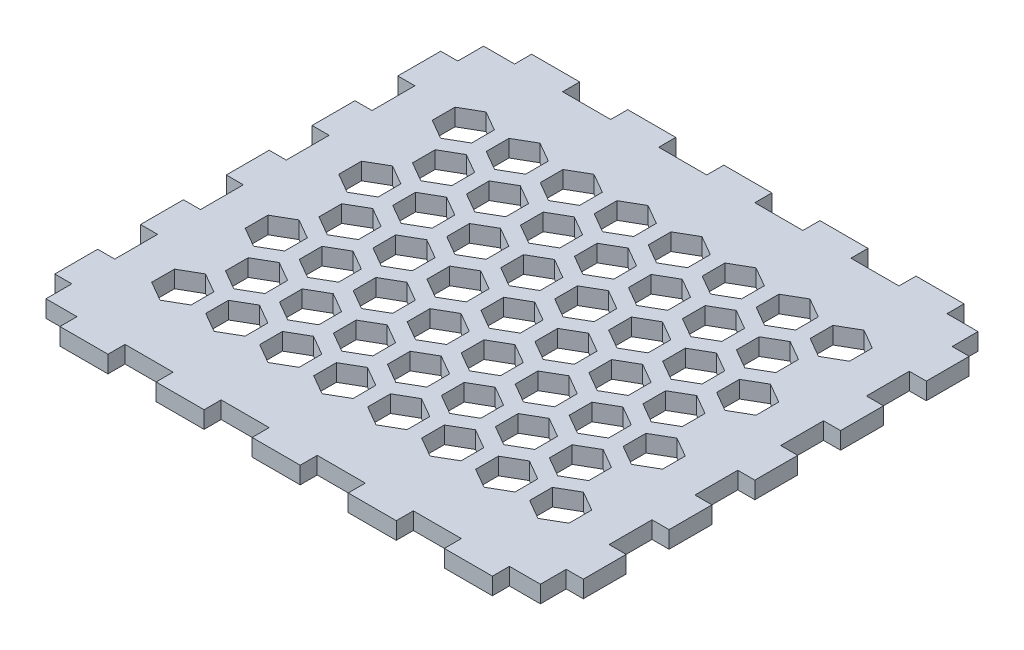
from build123d import *

# Parameters (mm, degrees)
AUFSATZ_LINEAR_AUSTRAGEN1_DEPTH = 3
F_LLMUSTER4_DEPTH               = 3


# Read off the part's stored shape, not the designer's step: Füllmuster4
with BuildPart() as part:
    # Skizze1 → Aufsatz-Linear austragen1 (new body)
    with BuildSketch(Plane(origin=(0, 0, 0), x_dir=(1, 0, 0), z_dir=(0, 1, 0))):
        Polygon((3.000248, 3.066206975), (8.45439, 3.066206975), (8.45439, 0.066212975), (16.908526, 0.066212975), (16.908526, 3.066206975), (25.364186, 3.066206975), (25.364186, 0.066212975), (33.818576, 0.066212975), (33.818576, 3.066206975), (42.272712, 3.066206975), (42.272712, 0.066212975), (50.727102, 0.066212975), (50.727102, 3.066206975), (59.181492, 3.066206975), (59.181492, 0.066212975), (67.636898, 0.066212975), (67.636898, 3.066206975), (76.091034, 3.066206975), (76.091034, 0.066212975), (84.545424, 0.066212975), (84.545424, 3.066206975), (89.99982, 3.066206975), (89.99982, 7.611028975), (92.999814, 7.611028975), (92.999814, 15.157368975), (89.99982, 15.157368975), (89.99982, 22.701930975), (92.999814, 22.701930975), (92.999814, 30.248016975), (89.99982, 30.248016975), (89.99982, 37.792832975), (92.999814, 37.792832975), (92.999814, 45.338918975), (89.99982, 45.338918975), (89.99982, 52.883734975), (92.999814, 52.883734975), (92.999814, 60.430074975), (89.99982, 60.430074975), (89.99982, 67.974382975), (92.999814, 67.974382975), (92.999814, 75.520722975), (89.99982, 75.520722975), (89.99982, 80.065544975), (84.545424, 80.065544975), (84.545424, 83.065538975), (76.091034, 83.065538975), (76.091034, 80.065544975), (67.636898, 80.065544975), (67.636898, 83.065538975), (59.181492, 83.065538975), (59.181492, 80.065544975), (50.727102, 80.065544975), (50.727102, 83.065538975), (42.272712, 83.065538975), (42.272712, 80.065544975), (33.818576, 80.065544975), (33.818576, 83.065538975), (25.364186, 83.065538975), (25.364186, 80.065544975), (16.908526, 80.065544975), (16.908526, 83.065538975), (8.45439, 83.065538975), (8.45439, 80.065544975), (3.000248, 80.065544975), (3.000248, 75.520722975), (0, 75.520722975), (0, 67.974382975), (3.000248, 67.974382975), (3.000248, 60.430074975), (0, 60.430074975), (0, 52.883734975), (3.000248, 52.883734975), (3.000248, 45.338918975), (0, 45.338918975), (0, 37.792832975), (3.000248, 37.792832975), (3.000248, 30.248016975), (0, 30.248016975), (0, 22.701930975), (3.000248, 22.701930975), (3.000248, 15.157368975), (0, 15.157368975), (0, 7.611028975), (3.000248, 7.611028975), align=None)
    extrude(amount=AUFSATZ_LINEAR_AUSTRAGEN1_DEPTH)

    # Füllmuster4 outline → Füllmuster4 (cut)
    with BuildSketch(Plane(origin=(0, 0, 0), x_dir=(1, 0, 0), z_dir=(0, 1, 0))):
        Polygon((9.785932385, 14.884151968), (13.250034, 12.884151968), (16.714135615, 14.884151968), (16.714135615, 18.884151968), (13.250034, 20.884151968), (9.785932385, 18.884151968), align=None)
        Polygon((9.785932385, 35.338634639), (9.785932385, 31.338634639), (13.250034, 29.338634639), (16.714135615, 31.338634639), (16.714135615, 35.338634639), (13.250034, 37.338634639), align=None)
        Polygon((9.785932385, 51.793117311), (9.785932385, 47.793117311), (13.250034, 45.793117311), (16.714135615, 47.793117311), (16.714135615, 51.793117311), (13.250034, 53.793117311), align=None)
        Polygon((9.785932385, 68.247599983), (9.785932385, 64.247599983), (13.250034, 62.247599983), (16.714135615, 64.247599983), (16.714135615, 68.247599983), (13.250034, 70.247599983), align=None)
        Polygon((56.000034, 45.565875975), (52.535932385, 43.565875975), (52.535932385, 39.565875975), (56.000034, 37.565875975), (59.464135615, 39.565875975), (59.464135615, 43.565875975), align=None)
        Polygon((41.750034, 37.338634639), (38.285932385, 35.338634639), (38.285932385, 31.338634639), (41.750034, 29.338634639), (45.214135615, 31.338634639), (45.214135615, 35.338634639), align=None)
        Polygon((27.500034, 29.111393304), (24.035932385, 27.111393304), (24.035932385, 23.111393304), (27.500034, 21.111393304), (30.964135615, 23.111393304), (30.964135615, 27.111393304), align=None)
        Polygon((70.250034, 53.793117311), (66.785932385, 51.793117311), (66.785932385, 47.793117311), (70.250034, 45.793117311), (73.714135615, 47.793117311), (73.714135615, 51.793117311), align=None)
        Polygon((66.785932385, 31.338634639), (70.250034, 29.338634639), (73.714135615, 31.338634639), (73.714135615, 35.338634639), (70.250034, 37.338634639), (66.785932385, 35.338634639), align=None)
        Polygon((24.035932385, 56.020358647), (27.500034, 54.020358647), (30.964135615, 56.020358647), (30.964135615, 60.020358647), (27.500034, 62.020358647), (24.035932385, 60.020358647), align=None)
        Polygon((38.285932385, 47.793117311), (41.750034, 45.793117311), (45.214135615, 47.793117311), (45.214135615, 51.793117311), (41.750034, 53.793117311), (38.285932385, 51.793117311), align=None)
        Polygon((66.785932385, 18.884151968), (66.785932385, 14.884151968), (70.250034, 12.884151968), (73.714135615, 14.884151968), (73.714135615, 18.884151968), (70.250034, 20.884151968), align=None)
        Polygon((66.785932385, 68.247599983), (66.785932385, 64.247599983), (70.250034, 62.247599983), (73.714135615, 64.247599983), (73.714135615, 68.247599983), (70.250034, 70.247599983), align=None)
        Polygon((41.750034, 20.884151968), (38.285932385, 18.884151968), (38.285932385, 14.884151968), (41.750034, 12.884151968), (45.214135615, 14.884151968), (45.214135615, 18.884151968), align=None)
        Polygon((56.000034, 29.111393304), (52.535932385, 27.111393304), (52.535932385, 23.111393304), (56.000034, 21.111393304), (59.464135615, 23.111393304), (59.464135615, 27.111393304), align=None)
        Polygon((76.285932385, 31.338634639), (79.750034, 29.338634639), (83.214135615, 31.338634639), (83.214135615, 35.338634639), (79.750034, 37.338634639), (76.285932385, 35.338634639), align=None)
        Polygon((62.035932385, 39.565875975), (65.500034, 37.565875975), (68.964135615, 39.565875975), (68.964135615, 43.565875975), (65.500034, 45.565875975), (62.035932385, 43.565875975), align=None)
        Polygon((33.535932385, 56.020358647), (37.000034, 54.020358647), (40.464135615, 56.020358647), (40.464135615, 60.020358647), (37.000034, 62.020358647), (33.535932385, 60.020358647), align=None)
        Polygon((19.285932385, 64.247599983), (22.750034, 62.247599983), (26.214135615, 64.247599983), (26.214135615, 68.247599983), (22.750034, 70.247599983), (19.285932385, 68.247599983), align=None)
        Polygon((47.785932385, 47.793117311), (51.250034, 45.793117311), (54.714135615, 47.793117311), (54.714135615, 51.793117311), (51.250034, 53.793117311), (47.785932385, 51.793117311), align=None)
        Polygon((76.285932385, 18.884151968), (76.285932385, 14.884151968), (79.750034, 12.884151968), (83.214135615, 14.884151968), (83.214135615, 18.884151968), (79.750034, 20.884151968), align=None)
        Polygon((76.285932385, 68.247599983), (76.285932385, 64.247599983), (79.750034, 62.247599983), (83.214135615, 64.247599983), (83.214135615, 68.247599983), (79.750034, 70.247599983), align=None)
        Polygon((76.285932385, 51.793117311), (76.285932385, 47.793117311), (79.750034, 45.793117311), (83.214135615, 47.793117311), (83.214135615, 51.793117311), (79.750034, 53.793117311), align=None)
        Polygon((65.500034, 29.111393304), (62.035932385, 27.111393304), (62.035932385, 23.111393304), (65.500034, 21.111393304), (68.964135615, 23.111393304), (68.964135615, 27.111393304), align=None)
        Polygon((51.250034, 20.884151968), (47.785932385, 18.884151968), (47.785932385, 14.884151968), (51.250034, 12.884151968), (54.714135615, 14.884151968), (54.714135615, 18.884151968), align=None)
        Polygon((33.535932385, 23.111393304), (37.000034, 21.111393304), (40.464135615, 23.111393304), (40.464135615, 27.111393304), (37.000034, 29.111393304), (33.535932385, 27.111393304), align=None)
        Polygon((19.285932385, 31.338634639), (22.750034, 29.338634639), (26.214135615, 31.338634639), (26.214135615, 35.338634639), (22.750034, 37.338634639), (19.285932385, 35.338634639), align=None)
        Polygon((33.535932385, 43.565875975), (33.535932385, 39.565875975), (37.000034, 37.565875975), (40.464135615, 39.565875975), (40.464135615, 43.565875975), (37.000034, 45.565875975), align=None)
        Polygon((51.250034, 37.338634639), (47.785932385, 35.338634639), (47.785932385, 31.338634639), (51.250034, 29.338634639), (54.714135615, 31.338634639), (54.714135615, 35.338634639), align=None)
        Polygon((22.750034, 20.884151968), (19.285932385, 18.884151968), (19.285932385, 14.884151968), (22.750034, 12.884151968), (26.214135615, 14.884151968), (26.214135615, 18.884151968), align=None)
        Polygon((43.035932385, 23.111393304), (46.500034, 21.111393304), (49.964135615, 23.111393304), (49.964135615, 27.111393304), (46.500034, 29.111393304), (43.035932385, 27.111393304), align=None)
        Polygon((28.785932385, 31.338634639), (32.250034, 29.338634639), (35.714135615, 31.338634639), (35.714135615, 35.338634639), (32.250034, 37.338634639), (28.785932385, 35.338634639), align=None)
        Polygon((57.285932385, 14.884151968), (60.750034, 12.884151968), (64.214135615, 14.884151968), (64.214135615, 18.884151968), (60.750034, 20.884151968), (57.285932385, 18.884151968), align=None)
        Polygon((14.535932385, 39.565875975), (18.000034, 37.565875975), (21.464135615, 39.565875975), (21.464135615, 43.565875975), (18.000034, 45.565875975), (14.535932385, 43.565875975), align=None)
        Polygon((43.035932385, 43.565875975), (43.035932385, 39.565875975), (46.500034, 37.565875975), (49.964135615, 39.565875975), (49.964135615, 43.565875975), (46.500034, 45.565875975), align=None)
        Polygon((43.035932385, 60.020358647), (43.035932385, 56.020358647), (46.500034, 54.020358647), (49.964135615, 56.020358647), (49.964135615, 60.020358647), (46.500034, 62.020358647), align=None)
        Polygon((32.250034, 20.884151968), (28.785932385, 18.884151968), (28.785932385, 14.884151968), (32.250034, 12.884151968), (35.714135615, 14.884151968), (35.714135615, 18.884151968), align=None)
        Polygon((75.000034, 45.565875975), (71.535932385, 43.565875975), (71.535932385, 39.565875975), (75.000034, 37.565875975), (78.464135615, 39.565875975), (78.464135615, 43.565875975), align=None)
        Polygon((60.750034, 37.338634639), (57.285932385, 35.338634639), (57.285932385, 31.338634639), (60.750034, 29.338634639), (64.214135615, 31.338634639), (64.214135615, 35.338634639), align=None)
        Polygon((38.285932385, 68.247599983), (38.285932385, 64.247599983), (41.750034, 62.247599983), (45.214135615, 64.247599983), (45.214135615, 68.247599983), (41.750034, 70.247599983), align=None)
        Polygon((71.535932385, 23.111393304), (75.000034, 21.111393304), (78.464135615, 23.111393304), (78.464135615, 27.111393304), (75.000034, 29.111393304), (71.535932385, 27.111393304), align=None)
        Polygon((14.535932385, 56.020358647), (18.000034, 54.020358647), (21.464135615, 56.020358647), (21.464135615, 60.020358647), (18.000034, 62.020358647), (14.535932385, 60.020358647), align=None)
        Polygon((28.785932385, 47.793117311), (32.250034, 45.793117311), (35.714135615, 47.793117311), (35.714135615, 51.793117311), (32.250034, 53.793117311), (28.785932385, 51.793117311), align=None)
        Polygon((71.535932385, 60.020358647), (71.535932385, 56.020358647), (75.000034, 54.020358647), (78.464135615, 56.020358647), (78.464135615, 60.020358647), (75.000034, 62.020358647), align=None)
        Polygon((19.285932385, 47.793117311), (22.750034, 45.793117311), (26.214135615, 47.793117311), (26.214135615, 51.793117311), (22.750034, 53.793117311), (19.285932385, 51.793117311), align=None)
        Polygon((62.035932385, 60.020358647), (62.035932385, 56.020358647), (65.500034, 54.020358647), (68.964135615, 56.020358647), (68.964135615, 60.020358647), (65.500034, 62.020358647), align=None)
        Polygon((24.035932385, 39.565875975), (27.500034, 37.565875975), (30.964135615, 39.565875975), (30.964135615, 43.565875975), (27.500034, 45.565875975), (24.035932385, 43.565875975), align=None)
        Polygon((52.535932385, 60.020358647), (52.535932385, 56.020358647), (56.000034, 54.020358647), (59.464135615, 56.020358647), (59.464135615, 60.020358647), (56.000034, 62.020358647), align=None)
        Polygon((14.535932385, 23.111393304), (18.000034, 21.111393304), (21.464135615, 23.111393304), (21.464135615, 27.111393304), (18.000034, 29.111393304), (14.535932385, 27.111393304), align=None)
        Polygon((28.785932385, 68.247599983), (28.785932385, 64.247599983), (32.250034, 62.247599983), (35.714135615, 64.247599983), (35.714135615, 68.247599983), (32.250034, 70.247599983), align=None)
        Polygon((57.285932385, 47.793117311), (60.750034, 45.793117311), (64.214135615, 47.793117311), (64.214135615, 51.793117311), (60.750034, 53.793117311), (57.285932385, 51.793117311), align=None)
        Polygon((47.785932385, 68.247599983), (47.785932385, 64.247599983), (51.250034, 62.247599983), (54.714135615, 64.247599983), (54.714135615, 68.247599983), (51.250034, 70.247599983), align=None)
        Polygon((57.285932385, 68.247599983), (57.285932385, 64.247599983), (60.750034, 62.247599983), (64.214135615, 64.247599983), (64.214135615, 68.247599983), (60.750034, 70.247599983), align=None)
    extrude(amount=F_LLMUSTER4_DEPTH, mode=Mode.SUBTRACT)


solid = part.part
